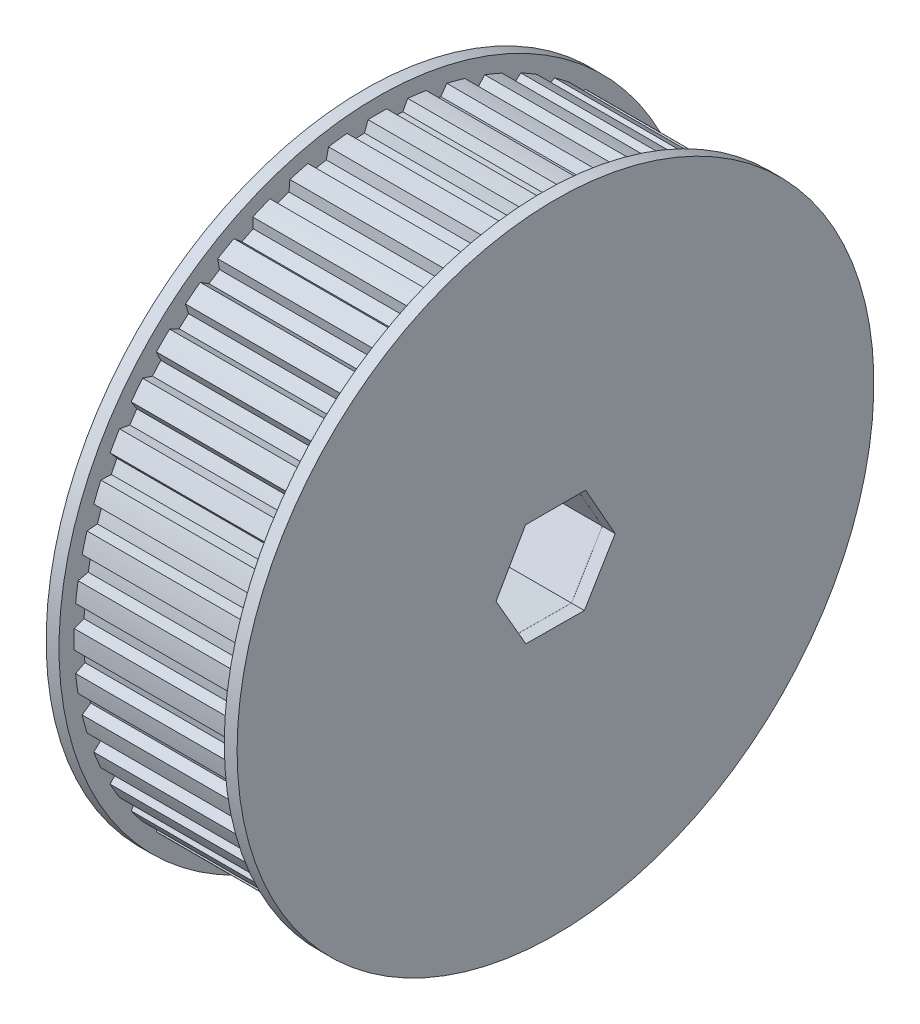
from build123d import *

# Parameters (mm, degrees)
SKETCH1_W                = 20.5
SKETCH1_H                = 37.625
CUT_EXTRUDE1_DEPTH       = 58.022199624
CUT_EXTRUDE2_DEPTH       = 58.022199624
CUT_EXTRUDE3_DEPTH       = 58.022199624
CUT_EXTRUDE4_DEPTH       = 58.022199624
CUT_EXTRUDE5_DEPTH       = 58.022199624
CUT_EXTRUDE6_DEPTH       = 58.022199624
CUT_EXTRUDE7_DEPTH       = 58.022199624
CUT_EXTRUDE8_DEPTH       = 58.022199624
CUT_EXTRUDE9_DEPTH       = 58.022199624
CUT_EXTRUDE10_DEPTH      = 58.022199624
CUT_EXTRUDE11_DEPTH      = 58.022199624
CUT_EXTRUDE12_DEPTH      = 58.022199624
CUT_EXTRUDE13_DEPTH      = 58.022199624
CUT_EXTRUDE14_DEPTH      = 58.022199624
CUT_EXTRUDE15_DEPTH      = 58.022199624
CUT_EXTRUDE16_DEPTH      = 58.022199624
CUT_EXTRUDE17_DEPTH      = 58.022199624
CUT_EXTRUDE18_DEPTH      = 58.022199624
CUT_EXTRUDE19_DEPTH      = 58.022199624
CUT_EXTRUDE20_DEPTH      = 58.022199624
CUT_EXTRUDE21_DEPTH      = 58.022199624
CUT_EXTRUDE22_DEPTH      = 58.022199624
CUT_EXTRUDE23_DEPTH      = 58.022199624
CUT_EXTRUDE24_DEPTH      = 58.022199624
CUT_EXTRUDE25_DEPTH      = 58.022199624
CUT_EXTRUDE26_DEPTH      = 58.022199624
CUT_EXTRUDE27_DEPTH      = 58.022199624
CUT_EXTRUDE28_DEPTH      = 58.022199624
CUT_EXTRUDE29_DEPTH      = 58.022199624
CUT_EXTRUDE30_DEPTH      = 58.022199624
CUT_EXTRUDE31_DEPTH      = 58.022199624
CUT_EXTRUDE32_DEPTH      = 58.022199624
CUT_EXTRUDE33_DEPTH      = 58.022199624
CUT_EXTRUDE34_DEPTH      = 58.022199624
CUT_EXTRUDE35_DEPTH      = 58.022199624
CUT_EXTRUDE36_DEPTH      = 58.022199624
CUT_EXTRUDE37_DEPTH      = 58.022199624
CUT_EXTRUDE38_DEPTH      = 58.022199624
CUT_EXTRUDE39_DEPTH      = 58.022199624
CUT_EXTRUDE40_DEPTH      = 58.022199624
CUT_EXTRUDE41_DEPTH      = 58.022199624
CUT_EXTRUDE42_DEPTH      = 58.022199624
CUT_EXTRUDE43_DEPTH      = 58.022199624
CUT_EXTRUDE44_DEPTH      = 58.022199624
CUT_EXTRUDE45_DEPTH      = 58.022199624
CUT_EXTRUDE46_DEPTH      = 58.022199624
CUT_EXTRUDE47_DEPTH      = 58.022199624
CUT_EXTRUDE48_DEPTH      = 58.022199624
SKETCH50_W               = 1.593169706
SKETCH50_H               = 39.5
F_2_0_2_DIAMETER_HOLE1_D = 2
SKETCH57_W               = 1.593169706
SKETCH57_H               = 39.5
CUT_EXTRUDE50_DEPTH      = 61.074201943
CUT_EXTRUDE50_DEPTH_BACK = 61.074201943


with BuildPart() as part:
    # Sketch1 → Revolve1 (revolve)
    with BuildSketch(Plane(origin=(0, 0, 0), x_dir=(-1, 0, 0), z_dir=(0, 0, -1))):
        with Locations((-10.25, 18.8125)):
            Rectangle(SKETCH1_W, SKETCH1_H)
    revolve(axis=Axis((20.5, 0, 0), (-1, 0, 0)))

    # Sketch2 → Cut-Extrude1 (cut, through all)
    with BuildSketch(Plane.ZY):
        with BuildLine():
            Line((-37.60720906, 1.156914747), (-36.389842333, 1.6))
            ThreePointArc((-36.389842333, 1.6), (-36.347011279, 2.382308982), (-36.287364095, 3.163515777))
            Line((-36.287364095, 3.163515777), (-37.43648185, 3.761708617))
            ThreePointArc((-37.43648185, 3.761708617), (-37.544441987, 2.460792737), (-37.60720906, 1.156914747))
        make_face()
    extrude(amount=-CUT_EXTRUDE1_DEPTH, mode=Mode.SUBTRACT)

    # Sketch3 → Cut-Extrude2 (cut, through all)
    with BuildSketch(Plane.ZY):
        with BuildLine():
            Line((-37.134466496, 6.05574298), (-35.869680279, 6.336139333))
            ThreePointArc((-35.869680279, 6.336139333), (-35.725103839, 7.106164979), (-35.563998996, 7.872902922))
            Line((-35.563998996, 7.872902922), (-36.625206056, 8.615968105))
            ThreePointArc((-36.625206056, 8.615968105), (-36.902046175, 7.340273366), (-37.134466496, 6.05574298))
        make_face()
    extrude(amount=-CUT_EXTRUDE2_DEPTH, mode=Mode.SUBTRACT)

    # Sketch4 → Cut-Extrude3 (cut, through all)
    with BuildSketch(Plane.ZY):
        with BuildLine():
            Line((-36.026342915, 10.850955771), (-34.735778052, 10.963865566))
            ThreePointArc((-34.735778052, 10.963865566), (-34.491929967, 11.708432524), (-34.232124014, 12.447582515))
            Line((-34.232124014, 12.447582515), (-35.187262832, 13.322805989))
            ThreePointArc((-35.187262832, 13.322805989), (-35.628246122, 12.094159882), (-36.026342915, 10.850955771))
        make_face()
    extrude(amount=-CUT_EXTRUDE3_DEPTH, mode=Mode.SUBTRACT)

    # Sketch5 → Cut-Extrude4 (cut, through all)
    with BuildSketch(Plane.ZY):
        with BuildLine():
            Line((-34.301798619, 15.4605057), (-33.007537031, 15.403997019))
            ThreePointArc((-33.007537031, 15.403997019), (-32.66858961, 16.110365541), (-32.3145279, 16.80928052))
            Line((-32.3145279, 16.80928052), (-33.147255785, 17.801686969))
            ThreePointArc((-33.147255785, 17.801686969), (-33.7448369, 16.641111969), (-34.301798619, 15.4605057))
        make_face()
    extrude(amount=-CUT_EXTRUDE4_DEPTH, mode=Mode.SUBTRACT)

    # Sketch6 → Cut-Extrude5 (cut, through all)
    with BuildSketch(Plane.ZY):
        with BuildLine():
            Line((-31.990341038, 19.805522091), (-30.7145279, 19.580561812))
            ThreePointArc((-30.7145279, 19.580561812), (-30.286280628, 20.236645738), (-29.844021254, 20.883367075))
            Line((-29.844021254, 20.883367075), (-30.540090001, 21.975976149))
            ThreePointArc((-30.540090001, 21.975976149), (-31.284044163, 20.903330017), (-31.990341038, 19.805522091))
        make_face()
    extrude(amount=-CUT_EXTRUDE5_DEPTH, mode=Mode.SUBTRACT)

    # Sketch7 → Cut-Extrude6 (cut, through all)
    with BuildSketch(Plane.ZY):
        with BuildLine():
            Line((-29.131519852, 23.811660507), (-27.895984681, 23.422097764))
            ThreePointArc((-27.895984681, 23.422097764), (-27.385764987, 24.016671315), (-26.86287513, 24.60013343))
            Line((-26.86287513, 24.60013343), (-27.410374811, 25.774250285))
            ThreePointArc((-27.410374811, 25.774250285), (-28.287972756, 24.807886293), (-29.131519852, 23.811660507))
        make_face()
    extrude(amount=-CUT_EXTRUDE6_DEPTH, mode=Mode.SUBTRACT)

    # Sketch8 → Cut-Extrude7 (cut, through all)
    with BuildSketch(Plane.ZY):
        with BuildLine():
            Line((-25.774250285, 27.410374811), (-24.60013343, 26.86287513))
            ThreePointArc((-24.60013343, 26.86287513), (-24.016671315, 27.385764987), (-23.422097764, 27.895984681))
            Line((-23.422097764, 27.895984681), (-23.811660507, 29.131519852))
            ThreePointArc((-23.811660507, 29.131519852), (-24.807886293, 28.287972756), (-25.774250285, 27.410374811))
        make_face()
    extrude(amount=-CUT_EXTRUDE7_DEPTH, mode=Mode.SUBTRACT)

    # Sketch9 → Cut-Extrude8 (cut, through all)
    with BuildSketch(Plane.ZY):
        with BuildLine():
            Line((-21.975976149, 30.540090001), (-20.883367075, 29.844021254))
            ThreePointArc((-20.883367075, 29.844021254), (-20.236645738, 30.286280628), (-19.580561812, 30.7145279))
            Line((-19.580561812, 30.7145279), (-19.805522091, 31.990341038))
            ThreePointArc((-19.805522091, 31.990341038), (-20.903330017, 31.284044163), (-21.975976149, 30.540090001))
        make_face()
    extrude(amount=-CUT_EXTRUDE8_DEPTH, mode=Mode.SUBTRACT)

    # Sketch10 → Cut-Extrude9 (cut, through all)
    with BuildSketch(Plane.ZY):
        with BuildLine():
            Line((-17.801686969, 33.147255785), (-16.80928052, 32.3145279))
            ThreePointArc((-16.80928052, 32.3145279), (-16.110365541, 32.66858961), (-15.403997019, 33.007537031))
            Line((-15.403997019, 33.007537031), (-15.4605057, 34.301798619))
            ThreePointArc((-15.4605057, 34.301798619), (-16.641111969, 33.7448369), (-17.801686969, 33.147255785))
        make_face()
    extrude(amount=-CUT_EXTRUDE9_DEPTH, mode=Mode.SUBTRACT)

    # Sketch11 → Cut-Extrude10 (cut, through all)
    with BuildSketch(Plane.ZY):
        with BuildLine():
            Line((-13.322805989, 35.187262832), (-12.447582515, 34.232124014))
            ThreePointArc((-12.447582515, 34.232124014), (-11.708432524, 34.491929967), (-10.963865566, 34.735778052))
            Line((-10.963865566, 34.735778052), (-10.850955771, 36.026342915))
            ThreePointArc((-10.850955771, 36.026342915), (-12.094159882, 35.628246122), (-13.322805989, 35.187262832))
        make_face()
    extrude(amount=-CUT_EXTRUDE10_DEPTH, mode=Mode.SUBTRACT)

    # Sketch12 → Cut-Extrude11 (cut, through all)
    with BuildSketch(Plane.ZY):
        with BuildLine():
            Line((-8.615968105, 36.625206056), (-7.872902922, 35.563998996))
            ThreePointArc((-7.872902922, 35.563998996), (-7.106164979, 35.725103839), (-6.336139333, 35.869680279))
            Line((-6.336139333, 35.869680279), (-6.05574298, 37.134466496))
            ThreePointArc((-6.05574298, 37.134466496), (-7.340273366, 36.902046175), (-8.615968105, 36.625206056))
        make_face()
    extrude(amount=-CUT_EXTRUDE11_DEPTH, mode=Mode.SUBTRACT)

    # Sketch13 → Cut-Extrude12 (cut, through all)
    with BuildSketch(Plane.ZY):
        with BuildLine():
            Line((-3.761708617, 37.43648185), (-3.163515777, 36.287364095))
            ThreePointArc((-3.163515777, 36.287364095), (-2.382308982, 36.347011279), (-1.6, 36.389842333))
            Line((-1.6, 36.389842333), (-1.156914747, 37.60720906))
            ThreePointArc((-1.156914747, 37.60720906), (-2.460792737, 37.544441987), (-3.761708617, 37.43648185))
        make_face()
    extrude(amount=-CUT_EXTRUDE12_DEPTH, mode=Mode.SUBTRACT)

    # Sketch14 → Cut-Extrude13 (cut, through all)
    with BuildSketch(Plane.ZY):
        with BuildLine():
            Line((1.156914747, 37.60720906), (1.6, 36.389842333))
            ThreePointArc((1.6, 36.389842333), (2.382308982, 36.347011279), (3.163515777, 36.287364095))
            Line((3.163515777, 36.287364095), (3.761708617, 37.43648185))
            ThreePointArc((3.761708617, 37.43648185), (2.460792737, 37.544441987), (1.156914747, 37.60720906))
        make_face()
    extrude(amount=-CUT_EXTRUDE13_DEPTH, mode=Mode.SUBTRACT)

    # Sketch15 → Cut-Extrude14 (cut, through all)
    with BuildSketch(Plane.ZY):
        with BuildLine():
            Line((6.05574298, 37.134466496), (6.336139333, 35.869680279))
            ThreePointArc((6.336139333, 35.869680279), (7.106164979, 35.725103839), (7.872902922, 35.563998996))
            Line((7.872902922, 35.563998996), (8.615968105, 36.625206056))
            ThreePointArc((8.615968105, 36.625206056), (7.340273366, 36.902046175), (6.05574298, 37.134466496))
        make_face()
    extrude(amount=-CUT_EXTRUDE14_DEPTH, mode=Mode.SUBTRACT)

    # Sketch16 → Cut-Extrude15 (cut, through all)
    with BuildSketch(Plane.ZY):
        with BuildLine():
            Line((10.850955771, 36.026342915), (10.963865566, 34.735778052))
            ThreePointArc((10.963865566, 34.735778052), (11.708432524, 34.491929967), (12.447582515, 34.232124014))
            Line((12.447582515, 34.232124014), (13.322805989, 35.187262832))
            ThreePointArc((13.322805989, 35.187262832), (12.094159882, 35.628246122), (10.850955771, 36.026342915))
        make_face()
    extrude(amount=-CUT_EXTRUDE15_DEPTH, mode=Mode.SUBTRACT)

    # Sketch17 → Cut-Extrude16 (cut, through all)
    with BuildSketch(Plane.ZY):
        with BuildLine():
            Line((15.4605057, 34.301798619), (15.403997019, 33.007537031))
            ThreePointArc((15.403997019, 33.007537031), (16.110365541, 32.66858961), (16.80928052, 32.3145279))
            Line((16.80928052, 32.3145279), (17.801686969, 33.147255785))
            ThreePointArc((17.801686969, 33.147255785), (16.641111969, 33.7448369), (15.4605057, 34.301798619))
        make_face()
    extrude(amount=-CUT_EXTRUDE16_DEPTH, mode=Mode.SUBTRACT)

    # Sketch18 → Cut-Extrude17 (cut, through all)
    with BuildSketch(Plane.ZY):
        with BuildLine():
            Line((19.805522091, 31.990341038), (19.580561812, 30.7145279))
            ThreePointArc((19.580561812, 30.7145279), (20.236645738, 30.286280628), (20.883367075, 29.844021254))
            Line((20.883367075, 29.844021254), (21.975976149, 30.540090001))
            ThreePointArc((21.975976149, 30.540090001), (20.903330017, 31.284044163), (19.805522091, 31.990341038))
        make_face()
    extrude(amount=-CUT_EXTRUDE17_DEPTH, mode=Mode.SUBTRACT)

    # Sketch19 → Cut-Extrude18 (cut, through all)
    with BuildSketch(Plane.ZY):
        with BuildLine():
            Line((23.811660507, 29.131519852), (23.422097764, 27.895984681))
            ThreePointArc((23.422097764, 27.895984681), (24.016671315, 27.385764987), (24.60013343, 26.86287513))
            Line((24.60013343, 26.86287513), (25.774250285, 27.410374811))
            ThreePointArc((25.774250285, 27.410374811), (24.807886293, 28.287972756), (23.811660507, 29.131519852))
        make_face()
    extrude(amount=-CUT_EXTRUDE18_DEPTH, mode=Mode.SUBTRACT)

    # Sketch20 → Cut-Extrude19 (cut, through all)
    with BuildSketch(Plane.ZY):
        with BuildLine():
            Line((27.410374811, 25.774250285), (26.86287513, 24.60013343))
            ThreePointArc((26.86287513, 24.60013343), (27.385764987, 24.016671315), (27.895984681, 23.422097764))
            Line((27.895984681, 23.422097764), (29.131519852, 23.811660507))
            ThreePointArc((29.131519852, 23.811660507), (28.287972756, 24.807886293), (27.410374811, 25.774250285))
        make_face()
    extrude(amount=-CUT_EXTRUDE19_DEPTH, mode=Mode.SUBTRACT)

    # Sketch21 → Cut-Extrude20 (cut, through all)
    with BuildSketch(Plane.ZY):
        with BuildLine():
            Line((30.540090001, 21.975976149), (29.844021254, 20.883367075))
            ThreePointArc((29.844021254, 20.883367075), (30.286280628, 20.236645738), (30.7145279, 19.580561812))
            Line((30.7145279, 19.580561812), (31.990341038, 19.805522091))
            ThreePointArc((31.990341038, 19.805522091), (31.284044163, 20.903330017), (30.540090001, 21.975976149))
        make_face()
    extrude(amount=-CUT_EXTRUDE20_DEPTH, mode=Mode.SUBTRACT)

    # Sketch22 → Cut-Extrude21 (cut, through all)
    with BuildSketch(Plane.ZY):
        with BuildLine():
            Line((33.147255785, 17.801686969), (32.3145279, 16.80928052))
            ThreePointArc((32.3145279, 16.80928052), (32.66858961, 16.110365541), (33.007537031, 15.403997019))
            Line((33.007537031, 15.403997019), (34.301798619, 15.4605057))
            ThreePointArc((34.301798619, 15.4605057), (33.7448369, 16.641111969), (33.147255785, 17.801686969))
        make_face()
    extrude(amount=-CUT_EXTRUDE21_DEPTH, mode=Mode.SUBTRACT)

    # Sketch23 → Cut-Extrude22 (cut, through all)
    with BuildSketch(Plane.ZY):
        with BuildLine():
            Line((35.187262832, 13.322805989), (34.232124014, 12.447582515))
            ThreePointArc((34.232124014, 12.447582515), (34.491929967, 11.708432524), (34.735778052, 10.963865566))
            Line((34.735778052, 10.963865566), (36.026342915, 10.850955771))
            ThreePointArc((36.026342915, 10.850955771), (35.628246122, 12.094159882), (35.187262832, 13.322805989))
        make_face()
    extrude(amount=-CUT_EXTRUDE22_DEPTH, mode=Mode.SUBTRACT)

    # Sketch24 → Cut-Extrude23 (cut, through all)
    with BuildSketch(Plane.ZY):
        with BuildLine():
            Line((36.625206056, 8.615968105), (35.563998996, 7.872902922))
            ThreePointArc((35.563998996, 7.872902922), (35.725103839, 7.106164979), (35.869680279, 6.336139333))
            Line((35.869680279, 6.336139333), (37.134466496, 6.05574298))
            ThreePointArc((37.134466496, 6.05574298), (36.902046175, 7.340273366), (36.625206056, 8.615968105))
        make_face()
    extrude(amount=-CUT_EXTRUDE23_DEPTH, mode=Mode.SUBTRACT)

    # Sketch25 → Cut-Extrude24 (cut, through all)
    with BuildSketch(Plane.ZY):
        with BuildLine():
            Line((37.43648185, 3.761708617), (36.287364095, 3.163515777))
            ThreePointArc((36.287364095, 3.163515777), (36.347011279, 2.382308982), (36.389842333, 1.6))
            Line((36.389842333, 1.6), (37.60720906, 1.156914747))
            ThreePointArc((37.60720906, 1.156914747), (37.544441987, 2.460792737), (37.43648185, 3.761708617))
        make_face()
    extrude(amount=-CUT_EXTRUDE24_DEPTH, mode=Mode.SUBTRACT)

    # Sketch26 → Cut-Extrude25 (cut, through all)
    with BuildSketch(Plane.ZY):
        with BuildLine():
            Line((37.60720906, -1.156914747), (36.389842333, -1.6))
            ThreePointArc((36.389842333, -1.6), (36.347011279, -2.382308982), (36.287364095, -3.163515777))
            Line((36.287364095, -3.163515777), (37.43648185, -3.761708617))
            ThreePointArc((37.43648185, -3.761708617), (37.544441987, -2.460792737), (37.60720906, -1.156914747))
        make_face()
    extrude(amount=-CUT_EXTRUDE25_DEPTH, mode=Mode.SUBTRACT)

    # Sketch27 → Cut-Extrude26 (cut, through all)
    with BuildSketch(Plane.ZY):
        with BuildLine():
            Line((37.134466496, -6.05574298), (35.869680279, -6.336139333))
            ThreePointArc((35.869680279, -6.336139333), (35.725103839, -7.106164979), (35.563998996, -7.872902922))
            Line((35.563998996, -7.872902922), (36.625206056, -8.615968105))
            ThreePointArc((36.625206056, -8.615968105), (36.902046175, -7.340273366), (37.134466496, -6.05574298))
        make_face()
    extrude(amount=-CUT_EXTRUDE26_DEPTH, mode=Mode.SUBTRACT)

    # Sketch28 → Cut-Extrude27 (cut, through all)
    with BuildSketch(Plane.ZY):
        with BuildLine():
            Line((36.026342915, -10.850955771), (34.735778052, -10.963865566))
            ThreePointArc((34.735778052, -10.963865566), (34.491929967, -11.708432524), (34.232124014, -12.447582515))
            Line((34.232124014, -12.447582515), (35.187262832, -13.322805989))
            ThreePointArc((35.187262832, -13.322805989), (35.628246122, -12.094159882), (36.026342915, -10.850955771))
        make_face()
    extrude(amount=-CUT_EXTRUDE27_DEPTH, mode=Mode.SUBTRACT)

    # Sketch29 → Cut-Extrude28 (cut, through all)
    with BuildSketch(Plane.ZY):
        with BuildLine():
            Line((34.301798619, -15.4605057), (33.007537031, -15.403997019))
            ThreePointArc((33.007537031, -15.403997019), (32.66858961, -16.110365541), (32.3145279, -16.80928052))
            Line((32.3145279, -16.80928052), (33.147255785, -17.801686969))
            ThreePointArc((33.147255785, -17.801686969), (33.7448369, -16.641111969), (34.301798619, -15.4605057))
        make_face()
    extrude(amount=-CUT_EXTRUDE28_DEPTH, mode=Mode.SUBTRACT)

    # Sketch30 → Cut-Extrude29 (cut, through all)
    with BuildSketch(Plane.ZY):
        with BuildLine():
            Line((31.990341038, -19.805522091), (30.7145279, -19.580561812))
            ThreePointArc((30.7145279, -19.580561812), (30.286280628, -20.236645738), (29.844021254, -20.883367075))
            Line((29.844021254, -20.883367075), (30.540090001, -21.975976149))
            ThreePointArc((30.540090001, -21.975976149), (31.284044163, -20.903330017), (31.990341038, -19.805522091))
        make_face()
    extrude(amount=-CUT_EXTRUDE29_DEPTH, mode=Mode.SUBTRACT)

    # Sketch31 → Cut-Extrude30 (cut, through all)
    with BuildSketch(Plane.ZY):
        with BuildLine():
            Line((29.131519852, -23.811660507), (27.895984681, -23.422097764))
            ThreePointArc((27.895984681, -23.422097764), (27.385764987, -24.016671315), (26.86287513, -24.60013343))
            Line((26.86287513, -24.60013343), (27.410374811, -25.774250285))
            ThreePointArc((27.410374811, -25.774250285), (28.287972756, -24.807886293), (29.131519852, -23.811660507))
        make_face()
    extrude(amount=-CUT_EXTRUDE30_DEPTH, mode=Mode.SUBTRACT)

    # Sketch32 → Cut-Extrude31 (cut, through all)
    with BuildSketch(Plane.ZY):
        with BuildLine():
            Line((25.774250285, -27.410374811), (24.60013343, -26.86287513))
            ThreePointArc((24.60013343, -26.86287513), (24.016671315, -27.385764987), (23.422097764, -27.895984681))
            Line((23.422097764, -27.895984681), (23.811660507, -29.131519852))
            ThreePointArc((23.811660507, -29.131519852), (24.807886293, -28.287972756), (25.774250285, -27.410374811))
        make_face()
    extrude(amount=-CUT_EXTRUDE31_DEPTH, mode=Mode.SUBTRACT)

    # Sketch33 → Cut-Extrude32 (cut, through all)
    with BuildSketch(Plane.ZY):
        with BuildLine():
            Line((21.975976149, -30.540090001), (20.883367075, -29.844021254))
            ThreePointArc((20.883367075, -29.844021254), (20.236645738, -30.286280628), (19.580561812, -30.7145279))
            Line((19.580561812, -30.7145279), (19.805522091, -31.990341038))
            ThreePointArc((19.805522091, -31.990341038), (20.903330017, -31.284044163), (21.975976149, -30.540090001))
        make_face()
    extrude(amount=-CUT_EXTRUDE32_DEPTH, mode=Mode.SUBTRACT)

    # Sketch34 → Cut-Extrude33 (cut, through all)
    with BuildSketch(Plane.ZY):
        with BuildLine():
            Line((17.801686969, -33.147255785), (16.80928052, -32.3145279))
            ThreePointArc((16.80928052, -32.3145279), (16.110365541, -32.66858961), (15.403997019, -33.007537031))
            Line((15.403997019, -33.007537031), (15.4605057, -34.301798619))
            ThreePointArc((15.4605057, -34.301798619), (16.641111969, -33.7448369), (17.801686969, -33.147255785))
        make_face()
    extrude(amount=-CUT_EXTRUDE33_DEPTH, mode=Mode.SUBTRACT)

    # Sketch35 → Cut-Extrude34 (cut, through all)
    with BuildSketch(Plane.ZY):
        with BuildLine():
            Line((13.322805989, -35.187262832), (12.447582515, -34.232124014))
            ThreePointArc((12.447582515, -34.232124014), (11.708432524, -34.491929967), (10.963865566, -34.735778052))
            Line((10.963865566, -34.735778052), (10.850955771, -36.026342915))
            ThreePointArc((10.850955771, -36.026342915), (12.094159882, -35.628246122), (13.322805989, -35.187262832))
        make_face()
    extrude(amount=-CUT_EXTRUDE34_DEPTH, mode=Mode.SUBTRACT)

    # Sketch36 → Cut-Extrude35 (cut, through all)
    with BuildSketch(Plane.ZY):
        with BuildLine():
            Line((8.615968105, -36.625206056), (7.872902922, -35.563998996))
            ThreePointArc((7.872902922, -35.563998996), (7.106164979, -35.725103839), (6.336139333, -35.869680279))
            Line((6.336139333, -35.869680279), (6.05574298, -37.134466496))
            ThreePointArc((6.05574298, -37.134466496), (7.340273366, -36.902046175), (8.615968105, -36.625206056))
        make_face()
    extrude(amount=-CUT_EXTRUDE35_DEPTH, mode=Mode.SUBTRACT)

    # Sketch37 → Cut-Extrude36 (cut, through all)
    with BuildSketch(Plane.ZY):
        with BuildLine():
            Line((3.761708617, -37.43648185), (3.163515777, -36.287364095))
            ThreePointArc((3.163515777, -36.287364095), (2.382308982, -36.347011279), (1.6, -36.389842333))
            Line((1.6, -36.389842333), (1.156914747, -37.60720906))
            ThreePointArc((1.156914747, -37.60720906), (2.460792737, -37.544441987), (3.761708617, -37.43648185))
        make_face()
    extrude(amount=-CUT_EXTRUDE36_DEPTH, mode=Mode.SUBTRACT)

    # Sketch38 → Cut-Extrude37 (cut, through all)
    with BuildSketch(Plane.ZY):
        with BuildLine():
            Line((-1.156914747, -37.60720906), (-1.6, -36.389842333))
            ThreePointArc((-1.6, -36.389842333), (-2.382308982, -36.347011279), (-3.163515777, -36.287364095))
            Line((-3.163515777, -36.287364095), (-3.761708617, -37.43648185))
            ThreePointArc((-3.761708617, -37.43648185), (-2.460792737, -37.544441987), (-1.156914747, -37.60720906))
        make_face()
    extrude(amount=-CUT_EXTRUDE37_DEPTH, mode=Mode.SUBTRACT)

    # Sketch39 → Cut-Extrude38 (cut, through all)
    with BuildSketch(Plane.ZY):
        with BuildLine():
            Line((-6.05574298, -37.134466496), (-6.336139333, -35.869680279))
            ThreePointArc((-6.336139333, -35.869680279), (-7.106164979, -35.725103839), (-7.872902922, -35.563998996))
            Line((-7.872902922, -35.563998996), (-8.615968105, -36.625206056))
            ThreePointArc((-8.615968105, -36.625206056), (-7.340273366, -36.902046175), (-6.05574298, -37.134466496))
        make_face()
    extrude(amount=-CUT_EXTRUDE38_DEPTH, mode=Mode.SUBTRACT)

    # Sketch40 → Cut-Extrude39 (cut, through all)
    with BuildSketch(Plane.ZY):
        with BuildLine():
            Line((-10.850955771, -36.026342915), (-10.963865566, -34.735778052))
            ThreePointArc((-10.963865566, -34.735778052), (-11.708432524, -34.491929967), (-12.447582515, -34.232124014))
            Line((-12.447582515, -34.232124014), (-13.322805989, -35.187262832))
            ThreePointArc((-13.322805989, -35.187262832), (-12.094159882, -35.628246122), (-10.850955771, -36.026342915))
        make_face()
    extrude(amount=-CUT_EXTRUDE39_DEPTH, mode=Mode.SUBTRACT)

    # Sketch41 → Cut-Extrude40 (cut, through all)
    with BuildSketch(Plane.ZY):
        with BuildLine():
            Line((-15.4605057, -34.301798619), (-15.403997019, -33.007537031))
            ThreePointArc((-15.403997019, -33.007537031), (-16.110365541, -32.66858961), (-16.80928052, -32.3145279))
            Line((-16.80928052, -32.3145279), (-17.801686969, -33.147255785))
            ThreePointArc((-17.801686969, -33.147255785), (-16.641111969, -33.7448369), (-15.4605057, -34.301798619))
        make_face()
    extrude(amount=-CUT_EXTRUDE40_DEPTH, mode=Mode.SUBTRACT)

    # Sketch42 → Cut-Extrude41 (cut, through all)
    with BuildSketch(Plane.ZY):
        with BuildLine():
            Line((-19.805522091, -31.990341038), (-19.580561812, -30.7145279))
            ThreePointArc((-19.580561812, -30.7145279), (-20.236645738, -30.286280628), (-20.883367075, -29.844021254))
            Line((-20.883367075, -29.844021254), (-21.975976149, -30.540090001))
            ThreePointArc((-21.975976149, -30.540090001), (-20.903330017, -31.284044163), (-19.805522091, -31.990341038))
        make_face()
    extrude(amount=-CUT_EXTRUDE41_DEPTH, mode=Mode.SUBTRACT)

    # Sketch43 → Cut-Extrude42 (cut, through all)
    with BuildSketch(Plane.ZY):
        with BuildLine():
            Line((-23.811660507, -29.131519852), (-23.422097764, -27.895984681))
            ThreePointArc((-23.422097764, -27.895984681), (-24.016671315, -27.385764987), (-24.60013343, -26.86287513))
            Line((-24.60013343, -26.86287513), (-25.774250285, -27.410374811))
            ThreePointArc((-25.774250285, -27.410374811), (-24.807886293, -28.287972756), (-23.811660507, -29.131519852))
        make_face()
    extrude(amount=-CUT_EXTRUDE42_DEPTH, mode=Mode.SUBTRACT)

    # Sketch44 → Cut-Extrude43 (cut, through all)
    with BuildSketch(Plane.ZY):
        with BuildLine():
            Line((-27.410374811, -25.774250285), (-26.86287513, -24.60013343))
            ThreePointArc((-26.86287513, -24.60013343), (-27.385764987, -24.016671315), (-27.895984681, -23.422097764))
            Line((-27.895984681, -23.422097764), (-29.131519852, -23.811660507))
            ThreePointArc((-29.131519852, -23.811660507), (-28.287972756, -24.807886293), (-27.410374811, -25.774250285))
        make_face()
    extrude(amount=-CUT_EXTRUDE43_DEPTH, mode=Mode.SUBTRACT)

    # Sketch45 → Cut-Extrude44 (cut, through all)
    with BuildSketch(Plane.ZY):
        with BuildLine():
            Line((-30.540090001, -21.975976149), (-29.844021254, -20.883367075))
            ThreePointArc((-29.844021254, -20.883367075), (-30.286280628, -20.236645738), (-30.7145279, -19.580561812))
            Line((-30.7145279, -19.580561812), (-31.990341038, -19.805522091))
            ThreePointArc((-31.990341038, -19.805522091), (-31.284044163, -20.903330017), (-30.540090001, -21.975976149))
        make_face()
    extrude(amount=-CUT_EXTRUDE44_DEPTH, mode=Mode.SUBTRACT)

    # Sketch46 → Cut-Extrude45 (cut, through all)
    with BuildSketch(Plane.ZY):
        with BuildLine():
            Line((-33.147255785, -17.801686969), (-32.3145279, -16.80928052))
            ThreePointArc((-32.3145279, -16.80928052), (-32.66858961, -16.110365541), (-33.007537031, -15.403997019))
            Line((-33.007537031, -15.403997019), (-34.301798619, -15.4605057))
            ThreePointArc((-34.301798619, -15.4605057), (-33.7448369, -16.641111969), (-33.147255785, -17.801686969))
        make_face()
    extrude(amount=-CUT_EXTRUDE45_DEPTH, mode=Mode.SUBTRACT)

    # Sketch47 → Cut-Extrude46 (cut, through all)
    with BuildSketch(Plane.ZY):
        with BuildLine():
            Line((-35.187262832, -13.322805989), (-34.232124014, -12.447582515))
            ThreePointArc((-34.232124014, -12.447582515), (-34.491929967, -11.708432524), (-34.735778052, -10.963865566))
            Line((-34.735778052, -10.963865566), (-36.026342915, -10.850955771))
            ThreePointArc((-36.026342915, -10.850955771), (-35.628246122, -12.094159882), (-35.187262832, -13.322805989))
        make_face()
    extrude(amount=-CUT_EXTRUDE46_DEPTH, mode=Mode.SUBTRACT)

    # Sketch48 → Cut-Extrude47 (cut, through all)
    with BuildSketch(Plane.ZY):
        with BuildLine():
            Line((-36.625206056, -8.615968105), (-35.563998996, -7.872902922))
            ThreePointArc((-35.563998996, -7.872902922), (-35.725103839, -7.106164979), (-35.869680279, -6.336139333))
            Line((-35.869680279, -6.336139333), (-37.134466496, -6.05574298))
            ThreePointArc((-37.134466496, -6.05574298), (-36.902046175, -7.340273366), (-36.625206056, -8.615968105))
        make_face()
    extrude(amount=-CUT_EXTRUDE47_DEPTH, mode=Mode.SUBTRACT)

    # Sketch49 → Cut-Extrude48 (cut, through all)
    with BuildSketch(Plane.ZY):
        with BuildLine():
            Line((-37.43648185, -3.761708617), (-36.287364095, -3.163515777))
            ThreePointArc((-36.287364095, -3.163515777), (-36.347011279, -2.382308982), (-36.389842333, -1.6))
            Line((-36.389842333, -1.6), (-37.60720906, -1.156914747))
            ThreePointArc((-37.60720906, -1.156914747), (-37.544441987, -2.460792737), (-37.43648185, -3.761708617))
        make_face()
    extrude(amount=-CUT_EXTRUDE48_DEPTH, mode=Mode.SUBTRACT)

    # Sketch50 → Revolve2 (revolve)
    with BuildSketch(Plane.XY):
        with Locations((-0.794018335, 19.75)):
            Rectangle(SKETCH50_W, SKETCH50_H)
    revolve(axis=Axis((-1.590603188, 0, 0), (1, 0, 0)))

    # Ø2.0 (2) Diameter Hole1 (through all)
    with Locations(Plane.ZY.offset(1.590603188)):
        with Locations((0, 0)):
            Hole(F_2_0_2_DIAMETER_HOLE1_D / 2)


with BuildPart() as body_2:
    # Sketch57 → Revolve5 (revolve)
    with BuildSketch(Plane.XY):
        with Locations((21.303409245, 19.75)):
            Rectangle(SKETCH57_W, SKETCH57_H)
    revolve(axis=Axis((20.506824392, 0, 0), (1, 0, 0)))


with BuildPart() as cut_extrude50_tool:
    # Sketch54 → Cut-Extrude50 (new, two sides: drawn at the far end of the back side and taken through both)
    with BuildSketch(Plane(origin=(0, 0, 0), x_dir=(0, 0, -1), z_dir=(1, 0, 0)).offset(-CUT_EXTRUDE50_DEPTH_BACK)):
        Polygon((-3.716057782, 6.4008), (-7.370453027, 0), (-3.674834463, -6.4008), (3.581785529, -6.45337831), (7.410944665, -0.10717391), (3.736756138, 6.4008), align=None)
    extrude(amount=CUT_EXTRUDE50_DEPTH + CUT_EXTRUDE50_DEPTH_BACK)


with BuildPart() as part_1:
    add(part.part)

    # Cut-Extrude50: cut by cut_extrude50_tool
    add(cut_extrude50_tool.part, mode=Mode.SUBTRACT)


with BuildPart() as body_2_1:
    add(body_2.part)

    # Cut-Extrude50: cut by cut_extrude50_tool
    add(cut_extrude50_tool.part, mode=Mode.SUBTRACT)


solid = Compound([part_1.part, body_2_1.part])
